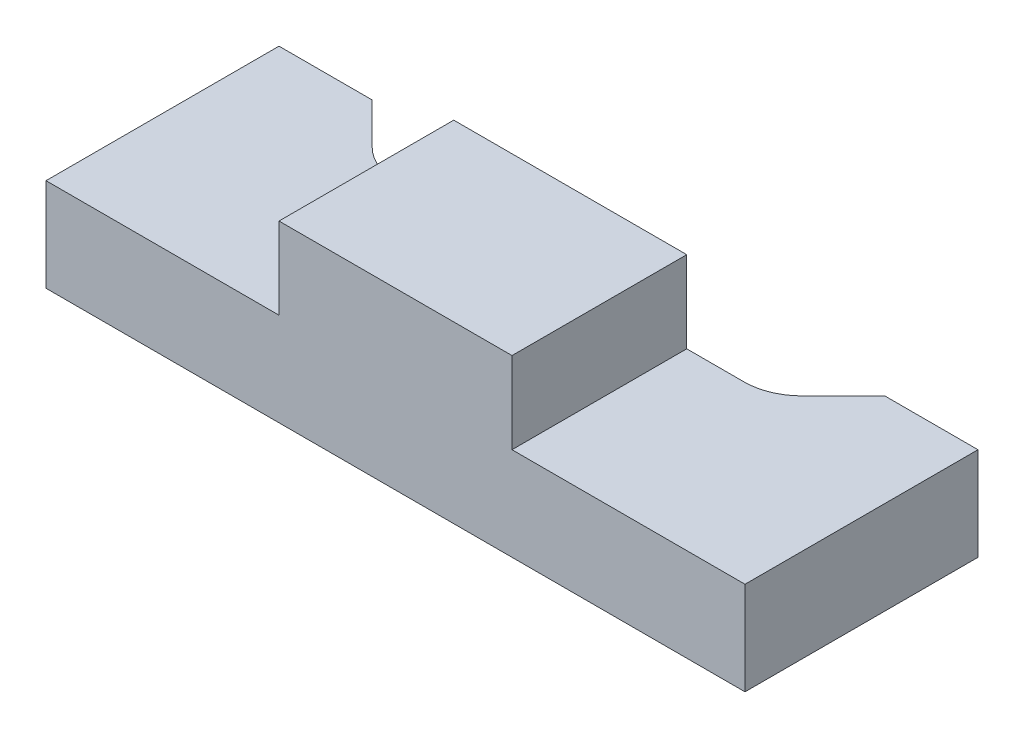
from build123d import *

# Parameters (mm, degrees)
BOSS_EXTRUDE2_DEPTH          = 20
TAP_DRILL_FOR_M10_TAP1_D     = 8.5
TAP_DRILL_FOR_M10_TAP1_DEPTH = 16
TAP_DRILL_FOR_M10_TAP1_TIP   = 2.553657631
CUT_EXTRUDE1_REACH           = 41.051
FILLET1_R                    = 5


with BuildPart() as part:
    # Sketch4 → Boss-Extrude2 (new body)
    with BuildSketch(Plane.XY):
        Polygon((-30, 0), (30, 0), (30, 8), (10, 8), (10, 15), (-10, 15), (-10, 8), (-30, 8), align=None)
    extrude(amount=BOSS_EXTRUDE2_DEPTH)

    # Tap Drill for M10 Tap1
    with Locations(Plane(origin=(0, 0, 0), x_dir=(-1, 0, 0), z_dir=(0, 0, -1))):
        with Locations((0, 9)):
            Hole(TAP_DRILL_FOR_M10_TAP1_D / 2, depth=TAP_DRILL_FOR_M10_TAP1_DEPTH)
            with Locations((0, 0, -(TAP_DRILL_FOR_M10_TAP1_DEPTH + TAP_DRILL_FOR_M10_TAP1_TIP / 2))):  # 118° drill point
                Cone(0, TAP_DRILL_FOR_M10_TAP1_D / 2, TAP_DRILL_FOR_M10_TAP1_TIP, mode=Mode.SUBTRACT)

    # Sketch7 → Cut-Extrude1 (cut, up to next)
    with BuildSketch(Plane(origin=(0, 15, 0), x_dir=(1, 0, 0), z_dir=(0, 1, 0)), mode=Mode.PRIVATE) as cut_extrude1_sk1:
        Polygon((-22, 0), (22, 0), (17, -5), (-17, -5), align=None)
    cut_extrude1_tool1 = extrude(cut_extrude1_sk1.sketch, amount=-CUT_EXTRUDE1_REACH, mode=Mode.PRIVATE) & part.part
    add(cut_extrude1_tool1.solids().sort_by_distance((0, 15, 2.393162))[0], mode=Mode.SUBTRACT)

    # Fillet1
    fillet1_edges = [part.edges().sort_by_distance(p)[0] for p in [
        (-17, 4, 5),
        (17, 4, 5),
    ]]
    fillet(fillet1_edges, radius=FILLET1_R)


solid = part.part
